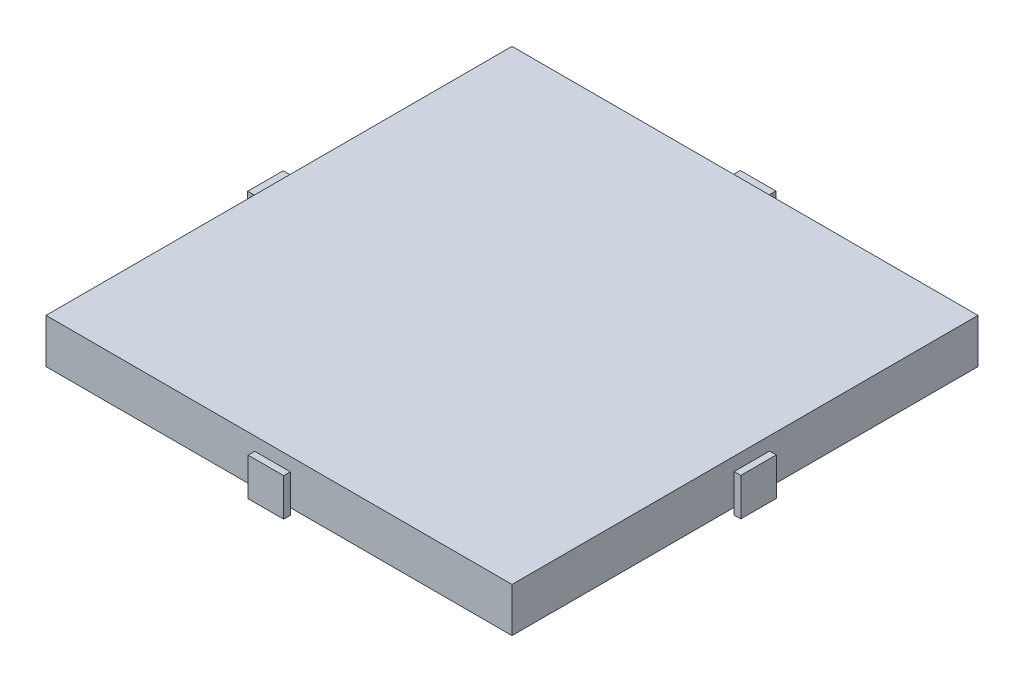
from build123d import *

# Parameters (mm, degrees)
CENTERSKETCH1_W                 = 210
CENTERSKETCH1_H                 = 210
CENTERBOSS_EXTRUDE1_DEPTH       = 20
SHELL2_T                        = -3
CENTERPEGSKETCH1_W              = 9.8
CENTERPEGSKETCH1_H              = 13.9
CENTERPEGBOSS_EXTRUDE1_DEPTH    = 3
CENTERPEGCAPSKETCH2_W           = 16
CENTERPEGCAPSKETCH2_H           = 17
CENTERPEGCAPBOSS_EXTRUDE2_DEPTH = 3
CENTERPEGBOSSSKETCH3_W          = 9.8
CENTERPEGBOSSSKETCH3_H          = 13.9
CENTERPEGBOSS_EXTRUDE3_DEPTH    = 3
CENTERPEGCAPSKETCH4_W           = 16
CENTERPEGCAPSKETCH4_H           = 17
CENTERPEGCAPBOSS_EXTRUDE4_DEPTH = 3
CENTERPEGSKETCH5_W              = 9.8
CENTERPEGSKETCH5_H              = 13.9
CENTERPEGBOSS_EXTRUDE5_DEPTH    = 3
CENTERPEGCAPSKETCH6_W           = 16
CENTERPEGCAPSKETCH6_H           = 17
CENTERPEGCAPBOSS_EXTRUDE6_DEPTH = 3
CENTERPEGSKETCH7_W              = 9.8
CENTERPEGSKETCH7_H              = 13.9
CENTERPEGBOSS_EXTRUDE7_DEPTH    = 3
CENTERPEGCAPSKETCH8_W           = 16
CENTERPEGCAPSKETCH8_H           = 17
CENTERPEGCAPBOSS_EXTRUDE8_DEPTH = 3


with BuildPart() as part:
    # CenterSketch1 → CenterBoss-Extrude1 (new body)
    with BuildSketch(Plane(origin=(0, 0, 0), x_dir=(1, 0, 0), z_dir=(0, 1, 0))):
        with Locations((105, 105)):
            Rectangle(CENTERSKETCH1_W, CENTERSKETCH1_H)
    extrude(amount=CENTERBOSS_EXTRUDE1_DEPTH)

    # Shell2
    shell2_openings = [part.faces().sort_by_distance(p)[0] for p in [
        (105, 0, -105),
    ]]
    offset(amount=SHELL2_T, openings=shell2_openings, kind=Kind.INTERSECTION)

    # CenterPegSketch1 → CenterPegBoss-Extrude1 (add)
    with BuildSketch(Plane(origin=(0, 0, -210), x_dir=(-1, 0, 0), z_dir=(0, 0, -1))):
        with Locations((-105, 6.95)):
            Rectangle(CENTERPEGSKETCH1_W, CENTERPEGSKETCH1_H)
    extrude(amount=CENTERPEGBOSS_EXTRUDE1_DEPTH)

    # CenterPegCapSketch2 → CenterPegCapBoss-Extrude2 (add)
    with BuildSketch(Plane(origin=(0, 0, -213), x_dir=(-1, 0, 0), z_dir=(0, 0, -1))):
        with Locations((-104.9, 8.5)):
            Rectangle(CENTERPEGCAPSKETCH2_W, CENTERPEGCAPSKETCH2_H)
    extrude(amount=CENTERPEGCAPBOSS_EXTRUDE2_DEPTH)

    # CenterPegBossSketch3 → CenterPegBoss-Extrude3 (add)
    with BuildSketch(Plane(origin=(210, 0, 0), x_dir=(0, 0, -1), z_dir=(1, 0, 0))):
        with Locations((105, 6.95)):
            Rectangle(CENTERPEGBOSSSKETCH3_W, CENTERPEGBOSSSKETCH3_H)
    extrude(amount=CENTERPEGBOSS_EXTRUDE3_DEPTH)

    # CenterPegCapSketch4 → CenterPegCapBoss-Extrude4 (add)
    with BuildSketch(Plane(origin=(213, 0, 0), x_dir=(0, 0, -1), z_dir=(1, 0, 0))):
        with Locations((105.1, 8.5)):
            Rectangle(CENTERPEGCAPSKETCH4_W, CENTERPEGCAPSKETCH4_H)
    extrude(amount=CENTERPEGCAPBOSS_EXTRUDE4_DEPTH)

    # CenterPegSketch5 → CenterPegBoss-Extrude5 (add)
    with BuildSketch(Plane.XY):
        with Locations((105, 6.95)):
            Rectangle(CENTERPEGSKETCH5_W, CENTERPEGSKETCH5_H)
    extrude(amount=CENTERPEGBOSS_EXTRUDE5_DEPTH)

    # CenterPegCapSketch6 → CenterPegCapBoss-Extrude6 (add)
    with BuildSketch(Plane.XY.offset(3)):
        with Locations((105.1, 8.5)):
            Rectangle(CENTERPEGCAPSKETCH6_W, CENTERPEGCAPSKETCH6_H)
    extrude(amount=CENTERPEGCAPBOSS_EXTRUDE6_DEPTH)

    # CenterPegSketch7 → CenterPegBoss-Extrude7 (add)
    with BuildSketch(Plane.ZY):
        with Locations((-105, 6.95)):
            Rectangle(CENTERPEGSKETCH7_W, CENTERPEGSKETCH7_H)
    extrude(amount=CENTERPEGBOSS_EXTRUDE7_DEPTH)

    # CenterPegCapSketch8 → CenterPegCapBoss-Extrude8 (add)
    with BuildSketch(Plane.ZY.offset(3)):
        with Locations((-104.9, 8.5)):
            Rectangle(CENTERPEGCAPSKETCH8_W, CENTERPEGCAPSKETCH8_H)
    extrude(amount=CENTERPEGCAPBOSS_EXTRUDE8_DEPTH)


solid = part.part
